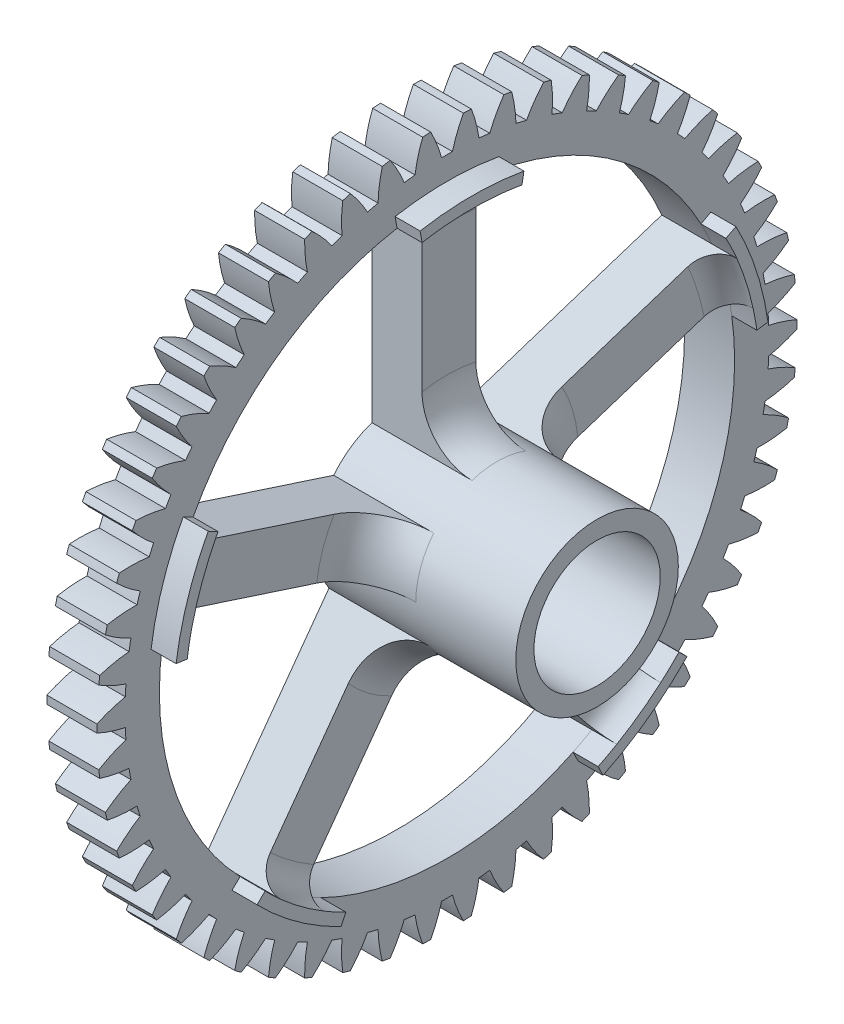
from build123d import *

# Parameters (mm, degrees)
BASPROSKE_W         = 2
BASPROSKE_H         = 14
TOOTHCUT_DEPTH      = 20.899748742
TEETHCUTS_COUNT     = 54
TEETHCUTS_ANGLE     = 353.333333333
BORSKE_R            = 0.5
BORE_DEPTH          = 50.0000508
SKETCH_13_R         = 3.25
SKETCH_13_R_2       = 2.525
EXTRUDE_1_DEPTH     = 6
SKETCH_17_R         = 2.525
CUT_EXTRUDE_1_DEPTH = 10
FILLET_1_R          = 2
EXTRUDE_2_DEPTH     = 1
FILLET_2_R          = 1


# Some blends are built 0.0001 mm under size
with BuildPart() as part:
    # BasProSke → Base-Revolve (revolve)
    with BuildSketch(Plane(origin=(0, 0, 0), x_dir=(1, 0, 0), z_dir=(0, 1, 0)), mode=Mode.PRIVATE) as base_revolve_sk:
        with Locations((1, 7)):
            Rectangle(BASPROSKE_W, BASPROSKE_H)
    revolve(base_revolve_sk.sketch.rotate(Axis((-10, 0, 0), (1, 0, 0)), 180), axis=Axis((-10, 0, 0), (1, 0, 0)))

    # TooCutSke → ToothCut (cut, through all)
    with BuildSketch(Plane(origin=(0, 0, 0), x_dir=(0, 0, -1), z_dir=(1, 0, 0))):
        with BuildLine():
            ThreePointArc((0.217036874, 12.872170407), (0, 12.874), (-0.217036874, 12.872170407))
            ThreePointArc((-0.217036874, 12.872170407), (-0.410004608, 13.45363645), (-0.667593614, 14.00950263))
            ThreePointArc((-0.667593614, 14.00950263), (0, 14.0254), (0.667593614, 14.00950263))
            ThreePointArc((0.667593614, 14.00950263), (0.410004608, 13.45363645), (0.217036874, 12.872170407))
        make_face()
    toothcut = extrude(amount=TOOTHCUT_DEPTH, mode=Mode.SUBTRACT)

    # TeethCuts: ToothCut ×54 about axis
    teethcuts_axis = Axis((-10, 0, 0), (1, 0, 0))
    for i in range(1, TEETHCUTS_COUNT):
        add(toothcut.rotate(teethcuts_axis, i * TEETHCUTS_ANGLE / (TEETHCUTS_COUNT - 1)), mode=Mode.SUBTRACT)

    # BorSke → Bore (cut, symmetric)
    with BuildSketch(Plane(origin=(0, 0, 0), x_dir=(0, 0, -1), z_dir=(1, 0, 0))):
        with Locations(Location((0, 0, 0), (0, 0, 180))):
            Circle(BORSKE_R)
    extrude(amount=BORE_DEPTH, both=True, mode=Mode.SUBTRACT)

    # 草图13 → 凸台-拉伸1 (add)
    with BuildSketch(Plane(origin=(2, 0, 0), x_dir=(0, 0, -1), z_dir=(1, 0, 0))):
        with Locations(Location((0, 0, 0), (0, 0, 180))):
            Circle(SKETCH_13_R)
        Circle(SKETCH_13_R_2, mode=Mode.SUBTRACT)
    extrude(amount=EXTRUDE_1_DEPTH)

    # 草图17 → 切除-拉伸1 (cut)
    with BuildSketch(Plane.ZY):
        Circle(SKETCH_17_R)
        with BuildLine():
            ThreePointArc((1, 3.092329219), (1.843080339, 2.676855406), (2.532013212, 2.037500698))
            Line((2.532013212, 2.037500698), (10.524794174, 4.63451266))
            ThreePointArc((10.524794174, 4.63451266), (6.696259459, 9.34933737), (1, 11.456439237))
            Line((1, 11.456439237), (1, 3.092329219))
        make_face()
        with BuildLine():
            Line((11.204738185, 2.589177903), (3.249996849, 0.004525765))
            ThreePointArc((3.249996849, 0.004525765), (3.115383924, -0.925679754), (2.720213428, -1.778465323))
            Line((2.720213428, -1.778465323), (7.660023727, -8.577530909))
            ThreePointArc((7.660023727, -8.577530909), (10.9610062, -3.47941706), (11.204738185, 2.589177903))
        make_face()
        with BuildLine():
            ThreePointArc((-2.63196286, 1.906638797), (-1.976297631, 2.580067378), (-1.155343203, 3.037710006))
            Line((-1.155343203, 3.037710006), (-1.155343203, 11.441817254))
            ThreePointArc((-1.155343203, 11.441817254), (-6.822490257, 9.257625327), (-10.586704196, 4.491290936))
            Line((-10.586704196, 4.491290936), (-2.63196286, 1.906638797))
        make_face()
        with BuildLine():
            Line((5.924909033, -9.85623929), (1.008608516, -3.089532143))
            ThreePointArc((1.008608516, -3.089532143), (0.082332814, -3.248956957), (-0.850828857, -3.136652715))
            Line((-0.850828857, -3.136652715), (-5.790639156, -9.935718302))
            ThreePointArc((-5.790639156, -9.935718302), (0.078014924, -11.499735374), (5.924909033, -9.85623929))
        make_face()
        with BuildLine():
            ThreePointArc((-2.626642505, -1.913961638), (-3.064499446, -1.082286073), (-3.24605458, -0.160092666))
            Line((-3.24605458, -0.160092666), (-11.238835542, 2.436919296))
            ThreePointArc((-11.238835542, 2.436919296), (-10.912790326, -3.627810263), (-7.542943022, -8.680668786))
            Line((-7.542943022, -8.680668786), (-2.626642505, -1.913961638))
        make_face()
    extrude(amount=-CUT_EXTRUDE_1_DEPTH, mode=Mode.SUBTRACT)

    # 圆角1
    # the kernel refuses this fillet: 2 mm, written as the material it adds along each edge
    with BuildSketch(Plane(origin=(2, 0, 0), x_dir=(0, 0.8189257886953276, 0.5738994272603308), z_dir=(0, 0.5738994272603308, -0.8189257886953276))) as fillet_1_piece_1_section:
        with BuildLine():
            CenterArc((3.25 + FILLET_1_R, FILLET_1_R), FILLET_1_R, 180, 90)
            Line((3.25, FILLET_1_R), (3.25, 0))
            Line((3.25, 0), (3.25 + FILLET_1_R, 0))
        make_face()
    fillet_1_piece_1 = revolve(axis=Axis((2, 0, 0), (1, 0, 0)), revolution_arc=215.051531954, mode=Mode.PRIVATE)
    fillet_1_piece_1 = split(fillet_1_piece_1, bisect_by=Plane(origin=(2.670708194, 3.193389648, 1.08406541), z_dir=(0, -0.587785252292473, 0.8090169943749476)), keep=Keep.TOP, mode=Mode.PRIVATE)
    fillet_1_piece_1 = split(fillet_1_piece_1, bisect_by=Plane(origin=(2.670708194, 0.044195803, 3.372088672), z_dir=(0, 0.9510565162951535, -0.3090169943749476)), keep=Keep.TOP, mode=Mode.PRIVATE)
    fillet_1_piece_1 = split(fillet_1_piece_1, bisect_by=Plane(origin=(2.670708194, 2.094049001, 2.706050994), z_dir=(0, -0.9510565162951535, 0.3090169943749475)), keep=Keep.TOP, mode=Mode.PRIVATE)
    add(fillet_1_piece_1)
    with BuildSketch(Plane(origin=(2, 0, 0), x_dir=(0, 0.8189257886953276, 0.5738994272603308), z_dir=(0, 0.5738994272603308, -0.8189257886953276))) as fillet_1_piece_2_section:
        with BuildLine():
            CenterArc((3.25 + FILLET_1_R, FILLET_1_R), FILLET_1_R, 180, 90)
            Line((3.25, FILLET_1_R), (3.25, 0))
            Line((3.25, 0), (3.25 + FILLET_1_R, 0))
        make_face()
    fillet_1_piece_2 = revolve(axis=Axis((2, 0, 0), (1, 0, 0)), revolution_arc=215.051531954, mode=Mode.PRIVATE)
    fillet_1_piece_2 = split(fillet_1_piece_2, bisect_by=Plane(origin=(2.447393243, -3.533005227, 1.330810572), z_dir=(0, 0.5877852522924735, 0.8090169943749472)), keep=Keep.TOP, mode=Mode.PRIVATE)
    fillet_1_piece_2 = split(fillet_1_piece_2, bisect_by=Plane(origin=(2.447393243, -2.266126278, 3.074519852), z_dir=(0, -0.5877852522924731, -0.8090169943749476)), keep=Keep.TOP, mode=Mode.PRIVATE)
    add(fillet_1_piece_2)
    with BuildSketch(Plane(origin=(2, 0, 0), x_dir=(0, 0.8189257886953276, 0.5738994272603308), z_dir=(0, 0.5738994272603308, -0.8189257886953276))) as fillet_1_piece_3_section:
        with BuildLine():
            CenterArc((3.25 + FILLET_1_R, FILLET_1_R), FILLET_1_R, 180, 90)
            Line((3.25, FILLET_1_R), (3.25, 0))
            Line((3.25, 0), (3.25 + FILLET_1_R, 0))
        make_face()
    fillet_1_piece_3 = revolve(axis=Axis((2, 0, 0), (1, 0, 0)), revolution_arc=215.051531954, mode=Mode.PRIVATE)
    fillet_1_piece_3 = split(fillet_1_piece_3, bisect_by=Plane(origin=(2.447393243, -2.357434722, -2.94884456), z_dir=(0, -0.587785252292473, 0.8090169943749476)), keep=Keep.TOP, mode=Mode.PRIVATE)
    fillet_1_piece_3 = split(fillet_1_piece_3, bisect_by=Plane(origin=(2.447393243, -3.624313671, -1.20513528), z_dir=(0, 0.587785252292473, -0.8090169943749476)), keep=Keep.TOP, mode=Mode.PRIVATE)
    fillet_1_piece_3 = split(fillet_1_piece_3, bisect_by=Plane(origin=(2.447393243, 0.203222358, -3.113315037), z_dir=(0, -0.9510565162951535, 0.3090169943749475)), keep=Keep.TOP, mode=Mode.PRIVATE)
    add(fillet_1_piece_3)
    with BuildSketch(Plane(origin=(2, 0, 0), x_dir=(0, -0.2927488041552596, 0.9561893837863217), z_dir=(0, 0.9561893837863217, 0.2927488041552596))) as fillet_1_piece_4_section:
        with BuildLine():
            CenterArc((3.25 + FILLET_1_R, FILLET_1_R), FILLET_1_R, 180, 90)
            Line((3.25, FILLET_1_R), (3.25, 0))
            Line((3.25, 0), (3.25 + FILLET_1_R, 0))
        make_face()
    fillet_1_piece_4 = revolve(axis=Axis((2, 0, 0), (1, 0, 0)), revolution_arc=215.051531954, mode=Mode.PRIVATE)
    fillet_1_piece_4 = split(fillet_1_piece_4, bisect_by=Plane(origin=(2.670708194, -3.193389651, 1.084065413), z_dir=(0, 0.5877852522924735, 0.8090169943749472)), keep=Keep.TOP, mode=Mode.PRIVATE)
    fillet_1_piece_4 = split(fillet_1_piece_4, bisect_by=Plane(origin=(2.670708194, -1.926510703, 2.827774693), z_dir=(0, -0.5877852522924731, -0.8090169943749476)), keep=Keep.TOP, mode=Mode.PRIVATE)
    fillet_1_piece_4 = split(fillet_1_piece_4, bisect_by=Plane(origin=(2.670708194, -0.044195802, 3.372088669), z_dir=(0, -0.9510565162951538, -0.30901699437494706)), keep=Keep.TOP, mode=Mode.PRIVATE)
    add(fillet_1_piece_4)
    with BuildSketch(Plane(origin=(2, 0, 0), x_dir=(0, -0.2927488041552596, 0.9561893837863217), z_dir=(0, 0.9561893837863217, 0.2927488041552596))) as fillet_1_piece_5_section:
        with BuildLine():
            CenterArc((3.25 + FILLET_1_R, FILLET_1_R), FILLET_1_R, 180, 90)
            Line((3.25, FILLET_1_R), (3.25, 0))
            Line((3.25, 0), (3.25 + FILLET_1_R, 0))
        make_face()
    fillet_1_piece_5 = revolve(axis=Axis((2, 0, 0), (1, 0, 0)), revolution_arc=215.051531954, mode=Mode.PRIVATE)
    fillet_1_piece_5 = split(fillet_1_piece_5, bisect_by=Plane(origin=(2.447393243, -2.357434722, -2.94884456), z_dir=(0, -0.587785252292473, 0.8090169943749476)), keep=Keep.TOP, mode=Mode.PRIVATE)
    fillet_1_piece_5 = split(fillet_1_piece_5, bisect_by=Plane(origin=(2.447393243, -3.624313671, -1.20513528), z_dir=(0, 0.587785252292473, -0.8090169943749476)), keep=Keep.TOP, mode=Mode.PRIVATE)
    add(fillet_1_piece_5)
    with BuildSketch(Plane(origin=(2, 0, 0), x_dir=(0, -0.2927488041552596, 0.9561893837863217), z_dir=(0, 0.9561893837863217, 0.2927488041552596))) as fillet_1_piece_6_section:
        with BuildLine():
            CenterArc((3.25 + FILLET_1_R, FILLET_1_R), FILLET_1_R, 180, 90)
            Line((3.25, FILLET_1_R), (3.25, 0))
            Line((3.25, 0), (3.25 + FILLET_1_R, 0))
        make_face()
    fillet_1_piece_6 = revolve(axis=Axis((2, 0, 0), (1, 0, 0)), revolution_arc=215.051531954, mode=Mode.PRIVATE)
    fillet_1_piece_6 = split(fillet_1_piece_6, bisect_by=Plane(origin=(2.447393243, 0.026177244, -3.819334416), z_dir=(0, 0.9510565162951536, 0.3090169943749473)), keep=Keep.TOP, mode=Mode.PRIVATE)
    fillet_1_piece_6 = split(fillet_1_piece_6, bisect_by=Plane(origin=(2.447393243, 3.023737715, -0.768791307), z_dir=(0, -0.5877852522924731, -0.8090169943749476)), keep=Keep.TOP, mode=Mode.PRIVATE)
    fillet_1_piece_6 = split(fillet_1_piece_6, bisect_by=Plane(origin=(2.447393243, 2.076030442, -3.153296737), z_dir=(0, -0.9510565162951538, -0.30901699437494706)), keep=Keep.TOP, mode=Mode.PRIVATE)
    add(fillet_1_piece_6)
    with BuildSketch(Plane(origin=(2, 0, 0), x_dir=(0, -0.9998544998291483, 0.017058111601346335), z_dir=(0, 0.017058111601346335, 0.9998544998291483))) as fillet_1_piece_7_section:
        with BuildLine():
            CenterArc((3.25 + FILLET_1_R, FILLET_1_R), FILLET_1_R, 180, 90)
            Line((3.25, FILLET_1_R), (3.25, 0))
            Line((3.25, 0), (3.25 + FILLET_1_R, 0))
        make_face()
    fillet_1_piece_7 = revolve(axis=Axis((2, 0, 0), (1, 0, 0)), revolution_arc=215.051531954, mode=Mode.PRIVATE)
    fillet_1_piece_7 = split(fillet_1_piece_7, bisect_by=Plane(origin=(2.670708194, -3.284698095, -0.958390121), z_dir=(0, 0.587785252292473, -0.8090169943749476)), keep=Keep.TOP, mode=Mode.PRIVATE)
    fillet_1_piece_7 = split(fillet_1_piece_7, bisect_by=Plane(origin=(2.670708194, -3.220704156, -1.155343203), z_dir=(0, 0, 1)), keep=Keep.TOP, mode=Mode.PRIVATE)
    fillet_1_piece_7 = split(fillet_1_piece_7, bisect_by=Plane(origin=(2.670708194, -3.220704156, 1), z_dir=(0, 0, -1)), keep=Keep.TOP, mode=Mode.PRIVATE)
    add(fillet_1_piece_7)
    with BuildSketch(Plane(origin=(2, 0, 0), x_dir=(0, -0.9998544998291483, 0.017058111601346335), z_dir=(0, 0.017058111601346335, 0.9998544998291483))) as fillet_1_piece_8_section:
        with BuildLine():
            CenterArc((3.25 + FILLET_1_R, FILLET_1_R), FILLET_1_R, 180, 90)
            Line((3.25, FILLET_1_R), (3.25, 0))
            Line((3.25, 0), (3.25 + FILLET_1_R, 0))
        make_face()
    fillet_1_piece_8 = revolve(axis=Axis((2, 0, 0), (1, 0, 0)), revolution_arc=215.051531954, mode=Mode.PRIVATE)
    fillet_1_piece_8 = split(fillet_1_piece_8, bisect_by=Plane(origin=(2.434908046, -2.37642228, -2.962639828), z_dir=(0, -0.587785252292473, 0.8090169943749476)), keep=Keep.TOP, mode=Mode.PRIVATE)
    fillet_1_piece_8 = split(fillet_1_piece_8, bisect_by=Plane(origin=(2.434908046, -3.643301228, -1.218930548), z_dir=(0, 0.587785252292473, -0.8090169943749476)), keep=Keep.TOP, mode=Mode.PRIVATE)
    fillet_1_piece_8 = split(fillet_1_piece_8, bisect_by=Plane(origin=(2.434908046, -2.979530774, 1), z_dir=(0, 0, -1)), keep=Keep.TOP, mode=Mode.PRIVATE)
    add(fillet_1_piece_8)
    with BuildSketch(Plane(origin=(2, 0, 0), x_dir=(0, -0.9998544998291483, 0.017058111601346335), z_dir=(0, 0.017058111601346335, 0.9998544998291483))) as fillet_1_piece_9_section:
        with BuildLine():
            CenterArc((3.25 + FILLET_1_R, FILLET_1_R), FILLET_1_R, 180, 90)
            Line((3.25, FILLET_1_R), (3.25, 0))
            Line((3.25, 0), (3.25 + FILLET_1_R, 0))
        make_face()
    fillet_1_piece_9 = revolve(axis=Axis((2, 0, 0), (1, 0, 0)), revolution_arc=215.051531954, mode=Mode.PRIVATE)
    fillet_1_piece_9 = split(fillet_1_piece_9, bisect_by=Plane(origin=(2.447393243, 0.026177244, -3.819334416), z_dir=(0, 0.9510565162951536, 0.3090169943749473)), keep=Keep.TOP, mode=Mode.PRIVATE)
    fillet_1_piece_9 = split(fillet_1_piece_9, bisect_by=Plane(origin=(2.447393243, 2.076030442, -3.153296737), z_dir=(0, -0.9510565162951538, -0.30901699437494706)), keep=Keep.TOP, mode=Mode.PRIVATE)
    add(fillet_1_piece_9)
    with BuildSketch(Plane(origin=(2, 0, 0), x_dir=(0, -0.3251952605435905, -0.9456468910327925), z_dir=(0, -0.9456468910327925, 0.3251952605435905))) as fillet_1_piece_10_section:
        with BuildLine():
            CenterArc((3.25 + FILLET_1_R, FILLET_1_R), FILLET_1_R, 180, 90)
            Line((3.25, FILLET_1_R), (3.25, 0))
            Line((3.25, 0), (3.25 + FILLET_1_R, 0))
        make_face()
    fillet_1_piece_10 = revolve(axis=Axis((2, 0, 0), (1, 0, 0)), revolution_arc=215.051531954, mode=Mode.PRIVATE)
    fillet_1_piece_10 = split(fillet_1_piece_10, bisect_by=Plane(origin=(2.670708194, -0.103544363, -3.420092362), z_dir=(0, 0.9510565162951536, 0.3090169943749473)), keep=Keep.TOP, mode=Mode.PRIVATE)
    fillet_1_piece_10 = split(fillet_1_piece_10, bisect_by=Plane(origin=(2.670708194, -1.946308834, -2.75405468), z_dir=(0, 0.9510565162951535, -0.3090169943749476)), keep=Keep.TOP, mode=Mode.PRIVATE)
    fillet_1_piece_10 = split(fillet_1_piece_10, bisect_by=Plane(origin=(2.670708194, 0.103544364, -3.420092359), z_dir=(0, -0.9510565162951535, 0.3090169943749475)), keep=Keep.TOP, mode=Mode.PRIVATE)
    add(fillet_1_piece_10)
    with BuildSketch(Plane(origin=(2, 0, 0), x_dir=(0, -0.3251952605435905, -0.9456468910327925), z_dir=(0, -0.9456468910327925, 0.3251952605435905))) as fillet_1_piece_11_section:
        with BuildLine():
            CenterArc((3.25 + FILLET_1_R, FILLET_1_R), FILLET_1_R, 180, 90)
            Line((3.25, FILLET_1_R), (3.25, 0))
            Line((3.25, 0), (3.25 + FILLET_1_R, 0))
        make_face()
    fillet_1_piece_11 = revolve(axis=Axis((2, 0, 0), (1, 0, 0)), revolution_arc=215.051531954, mode=Mode.PRIVATE)
    fillet_1_piece_11 = split(fillet_1_piece_11, bisect_by=Plane(origin=(2.434908046, 0.033429845, -3.841655628), z_dir=(0, 0.9510565162951536, 0.3090169943749473)), keep=Keep.TOP, mode=Mode.PRIVATE)
    fillet_1_piece_11 = split(fillet_1_piece_11, bisect_by=Plane(origin=(2.434908046, 2.083283044, -3.17561795), z_dir=(0, -0.9510565162951538, -0.30901699437494706)), keep=Keep.TOP, mode=Mode.PRIVATE)
    fillet_1_piece_11 = split(fillet_1_piece_11, bisect_by=Plane(origin=(2.434908046, 1.107433001, 1), z_dir=(0, 0, -1)), keep=Keep.TOP, mode=Mode.PRIVATE)
    add(fillet_1_piece_11)
    with BuildSketch(Plane(origin=(2, 0, 0), x_dir=(0, -0.3251952605435905, -0.9456468910327925), z_dir=(0, -0.9456468910327925, 0.3251952605435905))) as fillet_1_piece_12_section:
        with BuildLine():
            CenterArc((3.25 + FILLET_1_R, FILLET_1_R), FILLET_1_R, 180, 90)
            Line((3.25, FILLET_1_R), (3.25, 0))
            Line((3.25, 0), (3.25 + FILLET_1_R, 0))
        make_face()
    fillet_1_piece_12 = revolve(axis=Axis((2, 0, 0), (1, 0, 0)), revolution_arc=215.051531954, mode=Mode.PRIVATE)
    fillet_1_piece_12 = split(fillet_1_piece_12, bisect_by=Plane(origin=(2.447393243, 3.640492097, -1.155343203), z_dir=(0, 0, 1)), keep=Keep.TOP, mode=Mode.PRIVATE)
    fillet_1_piece_12 = split(fillet_1_piece_12, bisect_by=Plane(origin=(2.447393243, 3.640492097, 1), z_dir=(0, 0, -1)), keep=Keep.TOP, mode=Mode.PRIVATE)
    add(fillet_1_piece_12)
    with BuildSketch(Plane(origin=(2, 0, 0), x_dir=(0, 0.7988727758327576, -0.601500031615348), z_dir=(0, -0.601500031615348, -0.7988727758327576))) as fillet_1_piece_13_section:
        with BuildLine():
            CenterArc((3.25 + FILLET_1_R, FILLET_1_R), FILLET_1_R, 180, 90)
            Line((3.25, FILLET_1_R), (3.25, 0))
            Line((3.25, 0), (3.25 + FILLET_1_R, 0))
        make_face()
    fillet_1_piece_13 = revolve(axis=Axis((2, 0, 0), (1, 0, 0)), revolution_arc=215.051531954, mode=Mode.PRIVATE)
    fillet_1_piece_13 = split(fillet_1_piece_13, bisect_by=Plane(origin=(2.670708194, 2.017819144, -2.702099399), z_dir=(0, 0.5877852522924735, 0.8090169943749472)), keep=Keep.TOP, mode=Mode.PRIVATE)
    fillet_1_piece_13 = split(fillet_1_piece_13, bisect_by=Plane(origin=(2.670708194, 3.22070416, -1.155343203), z_dir=(0, 0, 1)), keep=Keep.TOP, mode=Mode.PRIVATE)
    fillet_1_piece_13 = split(fillet_1_piece_13, bisect_by=Plane(origin=(2.670708194, 3.22070416, 1), z_dir=(0, 0, -1)), keep=Keep.TOP, mode=Mode.PRIVATE)
    add(fillet_1_piece_13)
    with BuildSketch(Plane(origin=(2, 0, 0), x_dir=(0, 0.7988727758327576, -0.601500031615348), z_dir=(0, -0.601500031615348, -0.7988727758327576))) as fillet_1_piece_14_section:
        with BuildLine():
            CenterArc((3.25 + FILLET_1_R, FILLET_1_R), FILLET_1_R, 180, 90)
            Line((3.25, FILLET_1_R), (3.25, 0))
            Line((3.25, 0), (3.25 + FILLET_1_R, 0))
        make_face()
    fillet_1_piece_14 = revolve(axis=Axis((2, 0, 0), (1, 0, 0)), revolution_arc=215.051531954, mode=Mode.PRIVATE)
    fillet_1_piece_14 = split(fillet_1_piece_14, bisect_by=Plane(origin=(2.447393243, 0.17391741, 3.771330726), z_dir=(0, 0.9510565162951535, -0.3090169943749476)), keep=Keep.TOP, mode=Mode.PRIVATE)
    fillet_1_piece_14 = split(fillet_1_piece_14, bisect_by=Plane(origin=(2.447393243, 2.223770608, 3.105293048), z_dir=(0, -0.9510565162951535, 0.3090169943749475)), keep=Keep.TOP, mode=Mode.PRIVATE)
    add(fillet_1_piece_14)
    with BuildSketch(Plane(origin=(2, 0, 0), x_dir=(0, 0.7988727758327576, -0.601500031615348), z_dir=(0, -0.601500031615348, -0.7988727758327576))) as fillet_1_piece_15_section:
        with BuildLine():
            CenterArc((3.25 + FILLET_1_R, FILLET_1_R), FILLET_1_R, 180, 90)
            Line((3.25, FILLET_1_R), (3.25, 0))
            Line((3.25, 0), (3.25 + FILLET_1_R, 0))
        make_face()
    fillet_1_piece_15 = revolve(axis=Axis((2, 0, 0), (1, 0, 0)), revolution_arc=215.051531954, mode=Mode.PRIVATE)
    fillet_1_piece_15 = split(fillet_1_piece_15, bisect_by=Plane(origin=(2.447393243, -3.533005227, 1.330810572), z_dir=(0, 0.5877852522924735, 0.8090169943749472)), keep=Keep.TOP, mode=Mode.PRIVATE)
    fillet_1_piece_15 = split(fillet_1_piece_15, bisect_by=Plane(origin=(2.447393243, -2.266126278, 3.074519852), z_dir=(0, -0.5877852522924731, -0.8090169943749476)), keep=Keep.TOP, mode=Mode.PRIVATE)
    fillet_1_piece_15 = split(fillet_1_piece_15, bisect_by=Plane(origin=(2.447393243, -2.898139391, 1), z_dir=(0, 0, 1)), keep=Keep.TOP, mode=Mode.PRIVATE)
    add(fillet_1_piece_15)

    # 草图18 → 凸台-拉伸2 (add)
    with BuildSketch(Plane(origin=(2, 0, 0), x_dir=(0, 0, -1), z_dir=(1, 0, 0))):
        with BuildLine():
            Line((2.075095723, 11.768452648), (1.996934579, 11.32517877))
            ThreePointArc((1.996934579, 11.32517877), (0, 11.499887908), (-1.996934579, 11.32517877))
            Line((-1.996934579, 11.32517877), (-2.075095723, 11.768452648))
            ThreePointArc((-2.075095723, 11.768452648), (0, 11.95), (2.075095723, 11.768452648))
        make_face()
        with BuildLine():
            Line((10.551223735, 5.610185175), (10.153798346, 5.398870348))
            ThreePointArc((10.153798346, 5.398870348), (10.937043331, 3.553660797), (11.387971789, 1.600475061))
            Line((11.387971789, 1.600475061), (11.833703421, 1.663118556))
            ThreePointArc((11.833703421, 1.663118556), (11.36512537, 3.692753083), (10.551223735, 5.610185175))
        make_face()
        with BuildLine():
            Line((8.596110614, -8.301167527), (8.272327071, -7.988493394))
            ThreePointArc((8.272327071, -7.988493394), (6.759464515, -9.303604751), (5.04121905, -10.336030785))
            Line((5.04121905, -10.336030785), (5.238535204, -10.740588853))
            ThreePointArc((5.238535204, -10.740588853), (7.024033765, -9.667753083), (8.596110614, -8.301167527))
        make_face()
        with BuildLine():
            Line((-5.238535204, -10.740588853), (-5.04121905, -10.336030785))
            ThreePointArc((-5.04121905, -10.336030785), (-6.759464515, -9.303604751), (-8.272327071, -7.988493394))
            Line((-8.272327071, -7.988493394), (-8.596110614, -8.301167527))
            ThreePointArc((-8.596110614, -8.301167527), (-7.024033765, -9.667753083), (-5.238535204, -10.740588853))
        make_face()
        with BuildLine():
            Line((-11.833703421, 1.663118556), (-11.387971789, 1.600475061))
            ThreePointArc((-11.387971789, 1.600475061), (-10.937043331, 3.553660797), (-10.153798346, 5.398870348))
            Line((-10.153798346, 5.398870348), (-10.551223735, 5.610185175))
            ThreePointArc((-10.551223735, 5.610185175), (-11.36512537, 3.692753083), (-11.833703421, 1.663118556))
        make_face()
    extrude(amount=EXTRUDE_2_DEPTH)

    # 圆角2
    fillet_2_edges = [part.edges().sort_by_distance(p)[0] for p in [
        (2, 11.499623279, -0.07801493),
        (2, 3.62777563, 10.912683715),
        (2, -9.257534636, 6.822424375),
        (2, -9.349246687, -6.696193566),
        (2, 3.479382414, -10.960899594),
    ]]
    fillet(fillet_2_edges, radius=FILLET_2_R - 0.0001)  # a hair under: the kernel refuses the full size


solid = part.part
